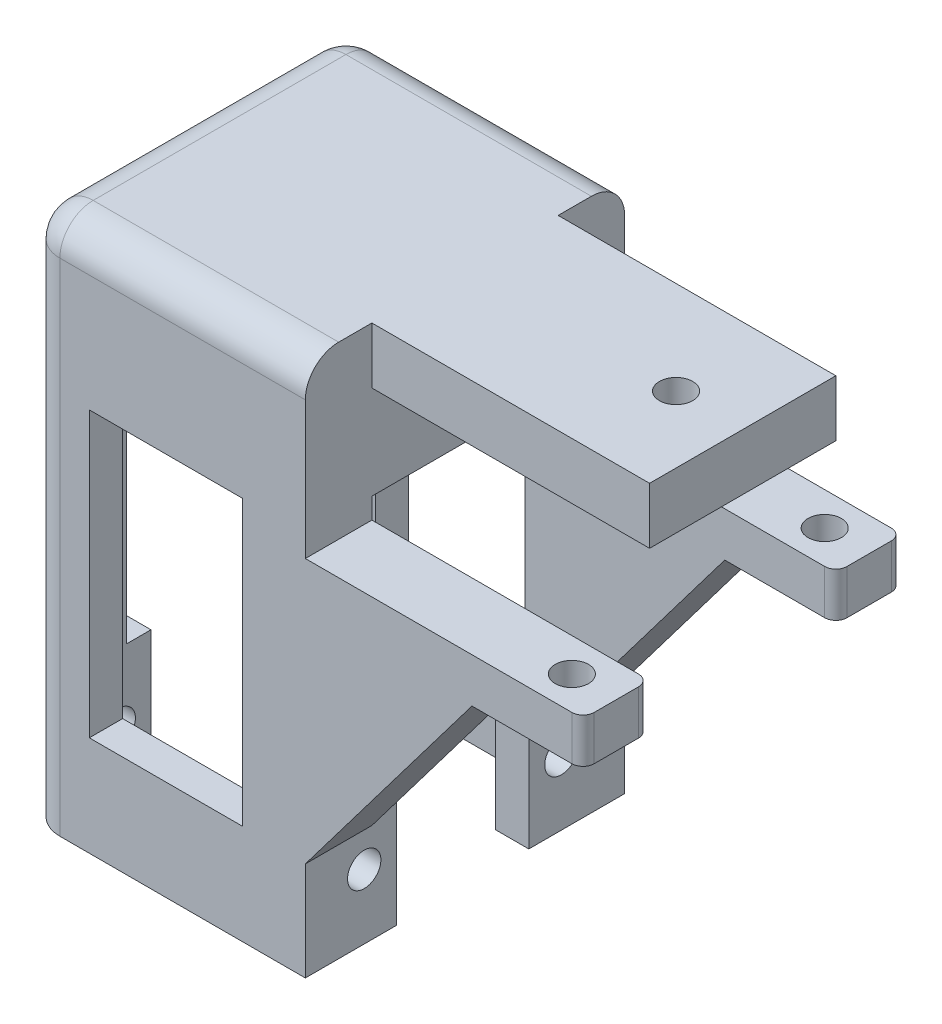
from build123d import *

# Parameters (mm, degrees)
SKETCH4_W            = 25.1
SKETCH4_H            = 28.75
BOSS_EXTRUDE2_DEPTH  = 53
SKETCH5_W            = 19.1
SKETCH5_H            = 22.75
CUT_EXTRUDE1_DEPTH   = 21.67
FILLET1_R            = 4.1
SKETCH6_W            = 5
SKETCH6_H            = 8
CUT_EXTRUDE2_DEPTH   = 4.67
SKETCH7_W            = 16.769550268
SKETCH7_H            = 35.14
CUT_EXTRUDE3_DEPTH   = 40
SKETCH8_W            = 13.798322684
SKETCH8_H            = 35.14
CUT_EXTRUDE4_DEPTH   = 40
BOSS_EXTRUDE3_DEPTH  = 17
SKETCH10_W           = 3
SKETCH10_H           = 9
BOSS_EXTRUDE4_DEPTH  = 13.8
SKETCH11_W           = 3
SKETCH11_H           = 9
BOSS_EXTRUDE5_DEPTH  = 13.8
SKETCH12_W           = 3
SKETCH12_H           = 12
BOSS_EXTRUDE6_DEPTH  = 16.77
SKETCH24_R           = 1.5
CUT_EXTRUDE6_DEPTH   = 40.8
SKETCH25_W           = 28.75
SKETCH25_H           = 21.925089144
CUT_EXTRUDE7_DEPTH   = 40.8
SKETCH26_W           = 11.913987102
SKETCH26_H           = 12
CUT_EXTRUDE8_DEPTH   = 40.8
SKETCH30_W           = 28.75
SKETCH30_H           = 5.07
BOSS_EXTRUDE10_DEPTH = 30
SKETCH32_W           = 5.990224866
SKETCH32_H           = 23.810252184
BOSS_EXTRUDE13_DEPTH = 30
CUT_EXTRUDE9_DEPTH   = 30
SKETCH36_W           = 5
SKETCH36_H           = 28.75
CUT_EXTRUDE10_DEPTH  = 30
SKETCH38_W           = 5.99
SKETCH38_H           = 5.07
CUT_EXTRUDE11_DEPTH  = 25
SKETCH39_R           = 1.5
CUT_EXTRUDE12_DEPTH  = 25
SKETCH40_R           = 1.5
CUT_EXTRUDE13_DEPTH  = 25
FILLET4_R            = 3
FILLET5_R            = 3
FILLET7_R            = 1


with BuildPart() as part:
    # Sketch4 → Boss-Extrude2 (new body)
    with BuildSketch(Plane(origin=(0, 0, 0), x_dir=(1, 0, 0), z_dir=(0, 1, 0))):
        Rectangle(SKETCH4_W, SKETCH4_H)
    extrude(amount=BOSS_EXTRUDE2_DEPTH)

    # Sketch5 → Cut-Extrude1 (cut)
    with BuildSketch(Plane(origin=(0, 0, 0), x_dir=(-1, 0, 0), z_dir=(0, -1, 0))):
        Rectangle(SKETCH5_W, SKETCH5_H)
    extrude(amount=-CUT_EXTRUDE1_DEPTH, mode=Mode.SUBTRACT)

    # Fillet1
    fillet1_edges = [part.edges().sort_by_distance(p)[0] for p in [
        (0, 21.67, -11.375),
        (0, 21.67, 11.375),
    ]]
    fillet(fillet1_edges, radius=FILLET1_R)

    # Sketch6 → Cut-Extrude2 (cut)
    with BuildSketch(Plane(origin=(0, 21.67, 0), x_dir=(-1, 0, 0), z_dir=(0, -1, 0))):
        Rectangle(SKETCH6_W, SKETCH6_H)
    extrude(amount=-CUT_EXTRUDE2_DEPTH, mode=Mode.SUBTRACT)

    # Sketch7 → Cut-Extrude3 (cut)
    with BuildSketch(Plane(origin=(12.55, 0, 0), x_dir=(0, 0, -1), z_dir=(1, 0, 0))):
        Rectangle(SKETCH7_W, SKETCH7_H)
    extrude(amount=-CUT_EXTRUDE3_DEPTH, mode=Mode.SUBTRACT)

    # Sketch8 → Cut-Extrude4 (cut)
    with BuildSketch(Plane(origin=(0, 0, -14.375), x_dir=(-1, 0, 0), z_dir=(0, 0, -1))):
        Rectangle(SKETCH8_W, SKETCH8_H)
    extrude(amount=-CUT_EXTRUDE4_DEPTH, mode=Mode.SUBTRACT)

    # Sketch9 → Boss-Extrude3 (add)
    with BuildSketch(Plane.XZ):
        Polygon((-9.55, 8.384775134), (-12.55, 8.384775134), (-12.55, 14.375), (-6.899161342, 14.375), (-6.899161342, 11.375), (-9.55, 11.375), align=None)
        Polygon((-9.55, -8.384775134), (-12.55, -8.384775134), (-12.55, -14.375), (-6.899161342, -14.375), (-6.899161342, -11.375), (-9.55, -11.375), align=None)
        Polygon((6.899161342, -11.375), (6.899161342, -14.375), (12.55, -14.375), (12.55, -8.384775134), (9.55, -8.384775134), (9.55, -11.375), align=None)
        Polygon((9.55, 8.384775134), (12.55, 8.384775134), (12.55, 14.375), (6.899161342, 14.375), (6.899161342, 11.375), (9.55, 11.375), align=None)
    extrude(amount=BOSS_EXTRUDE3_DEPTH)

    # Sketch10 → Boss-Extrude4 (add)
    with BuildSketch(Plane(origin=(-6.899161342, 0, 0), x_dir=(0, 0, -1), z_dir=(1, 0, 0))):
        with Locations((-12.875, -12.5)):
            Rectangle(SKETCH10_W, SKETCH10_H)
    extrude(amount=BOSS_EXTRUDE4_DEPTH)

    # Sketch11 → Boss-Extrude5 (add)
    with BuildSketch(Plane.ZY.offset(-6.899161342)):
        with Locations((-12.875, -12.5)):
            Rectangle(SKETCH11_W, SKETCH11_H)
    extrude(amount=BOSS_EXTRUDE5_DEPTH)

    # Sketch12 → Boss-Extrude6 (add)
    with BuildSketch(Plane.XY.offset(-8.384775134)):
        with Locations((-11.05, -11)):
            Rectangle(SKETCH12_W, SKETCH12_H)
        with Locations((11.05, -11)):
            Rectangle(SKETCH12_W, SKETCH12_H)
    extrude(amount=BOSS_EXTRUDE6_DEPTH)

    # Sketch24 → Cut-Extrude6 (cut)
    with BuildSketch(Plane(origin=(12.55, 0, 0), x_dir=(0, 0, -1), z_dir=(1, 0, 0))):
        with Locations((8.675, -11.18)):
            Circle(SKETCH24_R)
        with Locations((-9.075, -11.18)):
            Circle(SKETCH24_R)
    extrude(amount=-CUT_EXTRUDE6_DEPTH, mode=Mode.SUBTRACT)

    # Sketch25 → Cut-Extrude7 (cut)
    with BuildSketch(Plane.ZY.offset(12.55)):
        with Locations((0, 42.037455428)):
            Rectangle(SKETCH25_W, SKETCH25_H)
    extrude(amount=-CUT_EXTRUDE7_DEPTH, mode=Mode.SUBTRACT)

    # Sketch26 → Cut-Extrude8 (cut)
    with BuildSketch(Plane.ZY.offset(12.55)):
        with Locations((0.21531302, -11)):
            Rectangle(SKETCH26_W, SKETCH26_H)
    extrude(amount=-CUT_EXTRUDE8_DEPTH, mode=Mode.SUBTRACT)

    # Sketch30 → Boss-Extrude10 (add)
    with BuildSketch(Plane(origin=(12.55, 0, 0), x_dir=(0, 0, -1), z_dir=(1, 0, 0))):
        with Locations((0, 28.539910856)):
            Rectangle(SKETCH30_W, SKETCH30_H)
    extrude(amount=BOSS_EXTRUDE10_DEPTH)

    # Sketch32 → Boss-Extrude13 (add)
    with BuildSketch(Plane(origin=(12.55, 0, 0), x_dir=(0, 0, -1), z_dir=(1, 0, 0))):
        with Locations((-11.379887567, 3.799784764)):
            Rectangle(SKETCH32_W, SKETCH32_H)
        with Locations((11.379887567, 3.799784764)):
            Rectangle(SKETCH32_W, SKETCH32_H)
    extrude(amount=BOSS_EXTRUDE13_DEPTH)

    # Sketch35 → Cut-Extrude9 (cut)
    with BuildSketch(Plane(origin=(0, 0, -14.375), x_dir=(-1, 0, 0), z_dir=(0, 0, -1))):
        Polygon((-42.55, 11.704910856), (-27.55, 11.704910856), (-12.55, -8.105341328), (-42.55, -8.105341328), align=None)
    extrude(amount=-CUT_EXTRUDE9_DEPTH, mode=Mode.SUBTRACT)

    # Sketch36 → Cut-Extrude10 (cut)
    with BuildSketch(Plane(origin=(0, 31.074910856, 0), x_dir=(1, 0, 0), z_dir=(0, 1, 0))):
        with Locations((40.05, 0)):
            Rectangle(SKETCH36_W, SKETCH36_H)
    extrude(amount=-CUT_EXTRUDE10_DEPTH, mode=Mode.SUBTRACT)

    # Sketch38 → Cut-Extrude11 (cut)
    with BuildSketch(Plane(origin=(37.55, 0, 0), x_dir=(0, 0, -1), z_dir=(1, 0, 0))):
        with Locations((-11.38, 28.539910856)):
            Rectangle(SKETCH38_W, SKETCH38_H)
        with Locations((11.38, 28.539910856)):
            Rectangle(SKETCH38_W, SKETCH38_H)
    extrude(amount=-CUT_EXTRUDE11_DEPTH, mode=Mode.SUBTRACT)

    # Sketch39 → Cut-Extrude12 (cut)
    with BuildSketch(Plane(origin=(0, 11.704910856, 0), x_dir=(-1, 0, 0), z_dir=(0, -1, 0))):
        with Locations(Location((-33.55, 11.379887567, 0), (0, 0, 90))):
            Circle(SKETCH39_R)
        with Locations(Location((-33.55, -11.379887567, 0), (0, 0, 90))):
            Circle(SKETCH39_R)
    extrude(amount=-CUT_EXTRUDE12_DEPTH, mode=Mode.SUBTRACT)

    # Sketch40 → Cut-Extrude13 (cut)
    with BuildSketch(Plane.XZ.offset(-26.004910856)):
        with Locations(Location((31.55, 0, 0), (0, 0, 270))):
            Circle(SKETCH40_R)
    extrude(amount=-CUT_EXTRUDE13_DEPTH, mode=Mode.SUBTRACT)

    # Fillet4
    fillet4_edges = [part.edges().sort_by_distance(p)[0] for p in [
        (-12.55, 31.074910856, 0),
        (0, 31.074910856, 14.375),
        (0, 31.074910856, -14.375),
    ]]
    fillet(fillet4_edges, radius=FILLET4_R)

    # Fillet5
    # the kernel refuses this fillet: 3 mm, written as the material it takes off along each edge
    with BuildSketch(Plane(origin=(-9.55, 28.074910856, 11.375), x_dir=(0, 0, 1), z_dir=(-1, 0, 0))) as fillet5_piece_1_section:
        Polygon((0, 0), (FILLET5_R, 0), (FILLET5_R, FILLET5_R), (0, FILLET5_R), align=None)
    fillet5_piece_1 = extrude(amount=FILLET5_R, mode=Mode.PRIVATE)
    fillet5_piece_1 = fillet5_piece_1 - Plane(origin=(-9.55, 28.074910856, 11.375), x_dir=(0, -0.7071067811865475, -0.7071067811865475), z_dir=(-1, 0, 0)) * Sphere(FILLET5_R, mode=Mode.PRIVATE)
    add(fillet5_piece_1, mode=Mode.SUBTRACT)
    with BuildSketch(Plane(origin=(-9.55, 28.074910856, -11.375), x_dir=(-1, 0, 0), z_dir=(0, 0, -1))) as fillet5_piece_2_section:
        Polygon((0, 0), (FILLET5_R, 0), (FILLET5_R, FILLET5_R), (0, FILLET5_R), align=None)
    fillet5_piece_2 = extrude(amount=FILLET5_R, mode=Mode.PRIVATE)
    fillet5_piece_2 = fillet5_piece_2 - Plane(origin=(-9.55, 28.074910856, -11.375), x_dir=(0.7071067811865475, -0.7071067811865475, 0), z_dir=(0, 0, -1)) * Sphere(FILLET5_R, mode=Mode.PRIVATE)
    add(fillet5_piece_2, mode=Mode.SUBTRACT)
    with BuildSketch(Plane(origin=(-12.55, 28.074910856, -14.375), x_dir=(1, 0, 0), z_dir=(0, -1, 0))) as fillet5_piece_3:
        with BuildLine():
            CenterArc((FILLET5_R, FILLET5_R), FILLET5_R, 180, 90)
            Line((0, FILLET5_R), (0, 0))
            Line((0, 0), (FILLET5_R, 0))
        make_face()
    extrude(amount=52.574910856, mode=Mode.SUBTRACT)
    with BuildSketch(Plane(origin=(-12.55, -24.5, 14.375), x_dir=(0, 0, -1), z_dir=(0, 1, 0))) as fillet5_piece_4:
        with BuildLine():
            CenterArc((FILLET5_R, -FILLET5_R), FILLET5_R, 90, 90)
            Line((0, -FILLET5_R), (0, 0))
            Line((0, 0), (FILLET5_R, 0))
        make_face()
    extrude(amount=52.574910856, mode=Mode.SUBTRACT)

    # Fillet7
    fillet7_edges = [part.edges().sort_by_distance(p)[0] for p in [
        (37.55, 13.704910856, -14.375),
        (37.55, 13.704910856, -8.384775134),
        (37.55, 13.704910856, 14.375),
        (37.55, 13.704910856, 8.384775134),
    ]]
    fillet(fillet7_edges, radius=FILLET7_R)


solid = part.part
